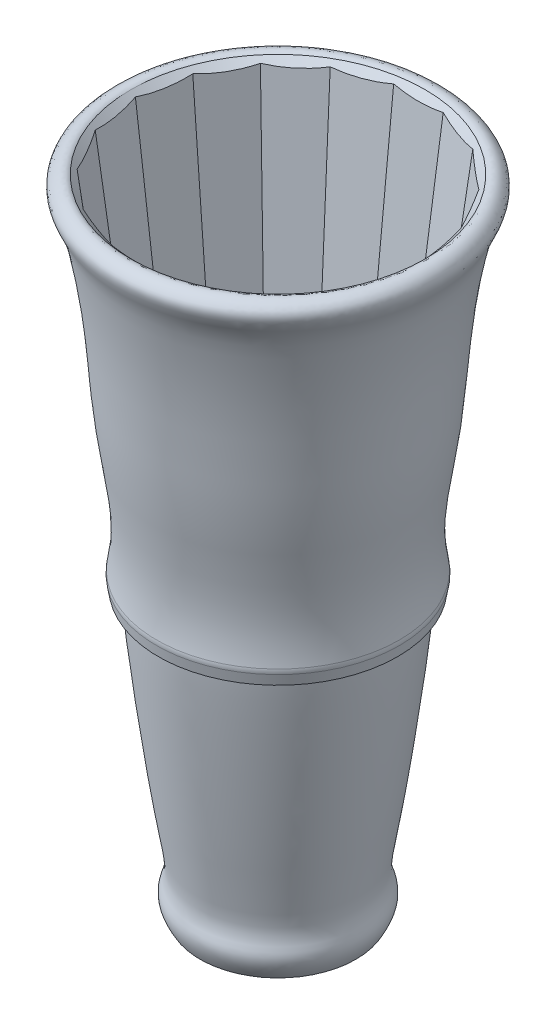
from build123d import *

# Parameters (mm, degrees)
LOFT1_DEPTH        = 508
LOFT1_TAPER        = -7.093868
SHELL1_T           = -19.05
SKETCH5_R          = 147.867108762
CUT_EXTRUDE1_DEPTH = 20
CUT_EXTRUDE2_DEPTH = 526.768458633
CUT_EXTRUDE2_TAPER = -20
CIRPATTERN1_COUNT  = 18


# Read off the part's stored shape, not the designer's step: Loft1
with BuildPart() as part:
    # Loft1 outline → Loft1 (new body)
    with BuildSketch(Plane(origin=(0, -508, 0), x_dir=(1, 0, 0), z_dir=(0, 1, 0))):
        Polygon((31.896938478, -55.24711805), (48.868944947, -41.005913681), (59.946635427, -21.81879094), (63.793876956, 0), (59.946635427, 21.81879094), (48.868944947, 41.005913681), (31.896938478, 55.24711805), (11.07769048, 62.824704621), (-11.07769048, 62.824704621), (-31.896938478, 55.24711805), (-48.868944947, 41.005913681), (-59.946635427, 21.81879094), (-63.793876956, 0), (-59.946635427, -21.81879094), (-48.868944947, -41.005913681), (-31.896938478, -55.24711805), (-11.07769048, -62.824704621), (11.07769048, -62.824704621), align=None)
    extrude(amount=LOFT1_DEPTH, taper=LOFT1_TAPER)

    # Shell1
    shell1_openings = [part.faces().sort_by_distance(p)[0] for p in [
        (0, 0, 0),
    ]]
    offset(amount=SHELL1_T, openings=shell1_openings, kind=Kind.INTERSECTION)

    # Sketch5 → Cut-Extrude1 (cut)
    with BuildSketch(Plane.XZ.offset(508)):
        Circle(SKETCH5_R)
    extrude(amount=-CUT_EXTRUDE1_DEPTH, mode=Mode.SUBTRACT)

    # Sketch6 → Cut-Extrude2 (cut, through all)
    with BuildSketch(Plane(origin=(-57.914835054, -472.553286642, -10.211948003), x_dir=(0.173648177666931, 0, -0.984807753012208), z_dir=(-0.12161910183404463, -0.9923451605496023, -0.021444729022872505))):
        Polygon((-11.516560933, 125.079390032), (-8.131620777, 106.029390032), (8.131620777, 106.029390032), (11.516560933, 125.079390032), align=None)
    cut_extrude2 = extrude(amount=CUT_EXTRUDE2_DEPTH, taper=CUT_EXTRUDE2_TAPER, mode=Mode.SUBTRACT)

    # CirPattern1: Cut-Extrude2 ×18 about axis
    cirpattern1_axis = Axis((0, 0, 0), (0, 1, 0))
    for i in range(1, CIRPATTERN1_COUNT):
        add(cut_extrude2.rotate(cirpattern1_axis, i * 360 / CIRPATTERN1_COUNT), mode=Mode.SUBTRACT)

    # Sketch8 → Cut-Revolve2 (revolve, cut)
    with BuildSketch(Plane.XY, mode=Mode.PRIVATE) as cut_revolve2_sk:
        with BuildLine():
            Line((57.063188191, -490.016704301), (76.914132607, -490.016704301))
            Line((76.914132607, -490.016704301), (141.822720492, 10.638098649))
            Line((141.822720492, 10.638098649), (99.989622053, 6.074813651))
            Line((99.989622053, 6.074813651), (101.324150646, -12.758188669))
            Line((101.324150646, -12.758188669), (110.947392304, -3.134947011))
            add(Edge.make_bspline(
                [(91.654671581, -261.912695347), (90.463529385, -255.888767597), (86.451439947, -226.144378116), (103.335951542, -149.18110791), (101.126839707, -94.048131142), (117.166658358, -23.542484516), (128.607726321, -8.097800622), (115.103303736, -0.326518025), (110.947392304, -3.134947011)],
                knots=[0.008161691, 0.008161691, 0.008161691, 0.008161691, 0.07525905, 0.338794378, 0.818332707, 0.879644944, 0.951916747, 1, 1, 1, 1], degree=3))
            ThreePointArc((91.654671581, -261.912695347), (91.843664316, -263.714577719), (91.704438434, -265.520987001))
            Line((91.704438434, -265.520987001), (90.364188475, -273.441057098))
            Line((90.364188475, -273.441057098), (83.863787721, -273.441057098))
            add(Edge.make_bspline(
                [(57.063188191, -490.016704301), (69.774426222, -470.358987533), (56.782755413, -467.955740887), (69.872367423, -400.532365878), (82.657499187, -297.566827785), (83.863787721, -273.441057098)],
                knots=[0, 0, 0, 0, 0.25681103, 0.397471242, 1, 1, 1, 1], degree=3))
        make_face()
    revolve(cut_revolve2_sk.sketch.rotate(Axis((0, 19.581938079, 0), (0, -1, 0)), 180), axis=Axis((0, 19.581938079, 0), (0, -1, 0)), mode=Mode.SUBTRACT)


solid = part.part
